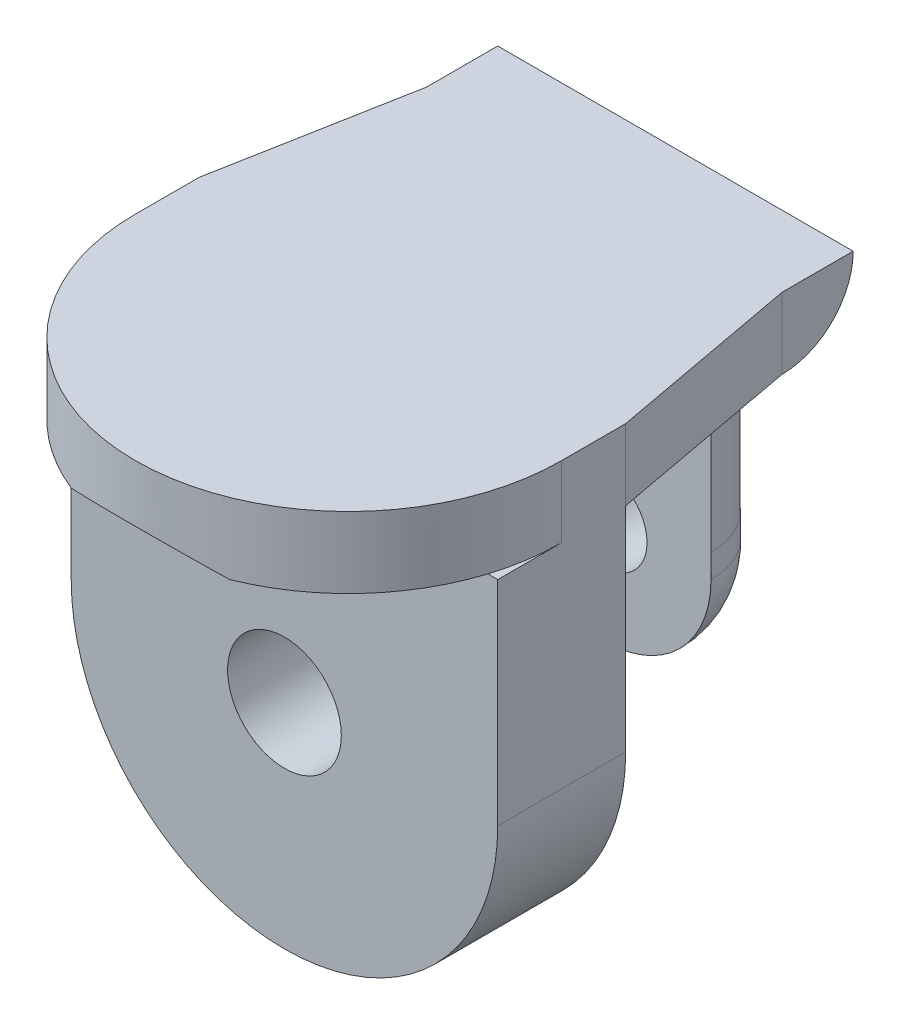
from build123d import *

# Parameters (mm, degrees)
SKETCH1_R            = 15
BOSS_EXTRUDE1_DEPTH  = 30
SKETCH8_W            = 30
SKETCH8_H            = 15
REVOLVE1_ANGLE       = 180
SKETCH9_W            = 30
SKETCH9_H            = 30
BOSS_EXTRUDE3_DEPTH  = 15
SKETCH10_R           = 5
CUT_EXTRUDE1_DEPTH   = 30
SKETCH13_R           = 16
CUT_EXTRUDE2_DEPTH   = 10
SKETCH14_W           = 10
SKETCH14_H           = 15
CUT_EXTRUDE3_DEPTH   = 67
CUT_EXTRUDE4_START   = -7
SKETCH15_R           = 11
SKETCH15_R_2         = 5
CUT_EXTRUDE4_DEPTH   = 7
SKETCH16_R           = 11
SKETCH16_R_2         = 5
CUT_EXTRUDE5_DEPTH   = 7
SKETCH17_R           = 15
SKETCH17_R_2         = 8
SKETCH17_R_3         = 3.5
BOSS_EXTRUDE4_DEPTH  = 2
BOSS_EXTRUDE5_DEPTH  = 5
BOSS_EXTRUDE6_DEPTH  = 16
SKETCH21_W           = 53
SKETCH21_H           = 30
CUT_EXTRUDE7_DEPTH   = 20
SKETCH23_W           = 15
SKETCH23_H           = 9
SKETCH24_W           = 30
SKETCH24_H           = 9
BOSS_EXTRUDE7_DEPTH  = 15
SKETCH25_R           = 4
CUT_EXTRUDE8_DEPTH   = 15
BOSS_EXTRUDE8_START  = 3
SKETCH26_W           = 10
SKETCH26_H           = 15
BOSS_EXTRUDE8_DEPTH  = 5
SKETCH30_W           = 30
SKETCH30_H           = 15
BOSS_EXTRUDE9_DEPTH  = 3
SKETCH27_R           = 16
CUT_EXTRUDE9_DEPTH   = 16
SKETCH28_R           = 16
CUT_EXTRUDE10_DEPTH  = 10.5
SKETCH29_R           = 16
CUT_EXTRUDE12_DEPTH  = 10
SKETCH31_W           = 53
SKETCH31_H           = 41.496728026
CUT_EXTRUDE13_DEPTH  = 37
BOSS_EXTRUDE10_DEPTH = 5
SKETCH35_W           = 30
SKETCH35_H           = 9
BOSS_EXTRUDE11_DEPTH = 5
SKETCH36_R           = 16
CUT_EXTRUDE14_DEPTH  = 13.5
SKETCH37_R           = 16
CUT_EXTRUDE15_DEPTH  = 18.5
FILLET1_R            = 5


with BuildPart() as part:
    # Sketch1 → Boss-Extrude1 (new body)
    with BuildSketch(Plane(origin=(0, 0, 0), x_dir=(1, 0, 0), z_dir=(0, 1, 0))):
        with Locations(Location((0, 0, 0), (0, 0, 270))):
            Circle(SKETCH1_R)
    extrude(amount=BOSS_EXTRUDE1_DEPTH)

    # Sketch8 → Revolve1 (revolve)
    with BuildSketch(Plane(origin=(0, 30, 0), x_dir=(1, 0, 0), z_dir=(0, 1, 0))):
        with Locations((0, -7.5)):
            Rectangle(SKETCH8_W, SKETCH8_H)
    revolve(axis=Axis((15, 30, 0), (-1, 0, 0)), revolution_arc=REVOLVE1_ANGLE)

    # Sketch9 → Boss-Extrude3 (add)
    with BuildSketch(Plane.XZ.offset(-30)):
        Rectangle(SKETCH9_W, SKETCH9_H)
    extrude(amount=BOSS_EXTRUDE3_DEPTH)

    # Sketch10 → Cut-Extrude1 (cut)
    with BuildSketch(Plane(origin=(15, 0, 0), x_dir=(0, 0, -1), z_dir=(1, 0, 0))):
        with Locations((0, 30)):
            Circle(SKETCH10_R)
    extrude(amount=-CUT_EXTRUDE1_DEPTH, mode=Mode.SUBTRACT)

    # Sketch13 → Cut-Extrude2 (cut)
    with BuildSketch(Plane(origin=(5, 0, 0), x_dir=(0, 0, -1), z_dir=(1, 0, 0))):
        with Locations((0, 30)):
            Circle(SKETCH13_R)
    extrude(amount=-CUT_EXTRUDE2_DEPTH, mode=Mode.SUBTRACT)

    # Sketch14 → Cut-Extrude3 (cut)
    with BuildSketch(Plane.XY.offset(15)):
        with Locations((0, 22.5)):
            Rectangle(SKETCH14_W, SKETCH14_H)
    extrude(amount=-CUT_EXTRUDE3_DEPTH, mode=Mode.SUBTRACT)

    # Sketch15 → Cut-Extrude4 (cut)
    with BuildSketch(Plane.ZY.offset(15).offset(CUT_EXTRUDE4_START)):
        with Locations((0, 30)):
            Circle(SKETCH15_R)
        with Locations(Location((0, 30, 0), (0, 0, 180))):
            Circle(SKETCH15_R_2, mode=Mode.SUBTRACT)
    extrude(amount=CUT_EXTRUDE4_DEPTH, mode=Mode.SUBTRACT)

    # Sketch16 → Cut-Extrude5 (cut)
    with BuildSketch(Plane(origin=(15, 0, 0), x_dir=(0, 0, -1), z_dir=(1, 0, 0))):
        with Locations(Location((0, 30, 0), (0, 0, 180))):
            Circle(SKETCH16_R)
        with Locations((0, 30)):
            Circle(SKETCH16_R_2, mode=Mode.SUBTRACT)
    extrude(amount=-CUT_EXTRUDE5_DEPTH, mode=Mode.SUBTRACT)



with BuildPart() as body_2:
    # Sketch17 → Boss-Extrude4 (new body)
    # profile 1 of 4: a face of its own
    with BuildSketch(Plane.ZY.offset(31)):
        with Locations((0, 30)):
            Circle(SKETCH17_R)
        with Locations((0, 30)):
            Circle(SKETCH17_R_2, mode=Mode.SUBTRACT)
    # profile 2 of 4: a face of its own
    with BuildSketch(Plane.ZY.offset(31)):
        with Locations((0, 30)):
            Circle(SKETCH17_R_2)
        with Locations((0, 30)):
            Circle(SKETCH17_R_3, mode=Mode.SUBTRACT)
    # profile 3 of 4: a face of its own
    with BuildSketch(Plane.ZY.offset(31)):
        with BuildLine():
            ThreePointArc((0, 15), (-10.606601718, 19.393398282), (-15, 30))
            Line((-15, 30), (-15, 15))
            Line((-15, 15), (0, 15))
        make_face()
    # profile 4 of 4: a face of its own
    with BuildSketch(Plane.ZY.offset(31)):
        with BuildLine():
            Line((15, 15), (15, 30))
            ThreePointArc((15, 30), (10.606601718, 19.393398282), (0, 15))
            Line((0, 15), (15, 15))
        make_face()
    extrude(amount=BOSS_EXTRUDE4_DEPTH)

    # Sketch18 → Boss-Extrude5 (add)
    with BuildSketch(Plane.ZY.offset(33)):
        with BuildLine():
            ThreePointArc((-8.5, 30), (0, 38.5), (8.5, 30))
            Line((8.5, 30), (8.5, 15))
            Line((8.5, 15), (15, 15))
            Line((15, 15), (15, 30))
            ThreePointArc((15, 30), (0, 45), (-15, 30))
            Line((-15, 30), (-15, 15))
            Line((-15, 15), (-8.5, 15))
            Line((-8.5, 15), (-8.5, 30))
        make_face()
    extrude(amount=BOSS_EXTRUDE5_DEPTH)


with BuildPart() as part_1:
    add(part.part)

    add(body_2.part)  # Boss-Extrude6 merges body 2
    # Sketch20 → Boss-Extrude6 (add)
    with BuildSketch(Plane.ZY.offset(15)):
        with BuildLine():
            ThreePointArc((11.5, 30), (0, 18.5), (-11.5, 30))
            Line((-11.5, 30), (-15, 30))
            Line((-15, 30), (-15, 15))
            Line((-15, 15), (0, 15))
            Line((0, 15), (15, 15))
            Line((15, 15), (15, 30))
            Line((15, 30), (11.5, 30))
        make_face()
    extrude(amount=BOSS_EXTRUDE6_DEPTH)

    # Sketch21 → Cut-Extrude7 (cut)
    with BuildSketch(Plane.XZ.offset(-15)):
        with Locations((-11.5, 0)):
            Rectangle(SKETCH21_W, SKETCH21_H)
    extrude(amount=CUT_EXTRUDE7_DEPTH, mode=Mode.SUBTRACT)


with BuildPart() as cut_extrude7_piece_1:
    # of the separate pieces the step leaves, piece 1, a body of its own (cut_extrude7_pieces)
    add(part_1.part.solids().sort_by_distance((-31, 30, 15))[0])



with BuildPart() as cut_extrude7_piece_2:
    # of the separate pieces the step leaves, piece 2, a body of its own (cut_extrude7_pieces)
    add(part_1.part.solids().sort_by_distance((5, 15, -15))[0])


with BuildPart() as body_3:
    # Sketch23 → Revolve2 (revolve)
    with BuildSketch(Plane(origin=(0, 0, 0), x_dir=(-1, 0, 0), z_dir=(0, -1, 0)), mode=Mode.PRIVATE) as revolve2_sk:
        with Locations((-7.5, 0)):
            Rectangle(SKETCH23_W, SKETCH23_H)
    revolve(revolve2_sk.sketch.rotate(Axis((0, 0, 4.5), (0, 0, -1)), 90), axis=Axis((0, 0, 4.5), (0, 0, -1)))


with BuildPart() as cut_extrude7_piece_1_1:
    add(cut_extrude7_piece_1.part)

    add(cut_extrude7_piece_2.part)  # Boss-Extrude7 merges Cut-Extrude7 piece 2

    add(body_3.part)  # Boss-Extrude7 merges body 3
    # Sketch24 → Boss-Extrude7 (add)
    with BuildSketch(Plane.XZ.offset(-15)):
        Rectangle(SKETCH24_W, SKETCH24_H)
    extrude(amount=BOSS_EXTRUDE7_DEPTH)

    # Sketch25 → Cut-Extrude8 (cut)
    with BuildSketch(Plane.XY.offset(4.5)):
        Circle(SKETCH25_R)
    extrude(amount=-CUT_EXTRUDE8_DEPTH, mode=Mode.SUBTRACT)



with BuildPart() as body_2_2:
    # Sketch26 → Boss-Extrude8 (new body)
    with BuildSketch(Plane(origin=(0, 0, -15), x_dir=(-1, 0, 0), z_dir=(0, 0, -1)).offset(BOSS_EXTRUDE8_START)):
        with Locations((-10, 22.5)):
            Rectangle(SKETCH26_W, SKETCH26_H)
        with BuildLine():
            Line((15, 30), (-5, 30))
            Line((-5, 30), (-5, 15))
            Line((-5, 15), (-12.5, 15))
            ThreePointArc((-12.5, 15), (-8.964466094, 13.535533906), (-7.5, 10))
            Line((-7.5, 10), (-7.5, 0))
            ThreePointArc((-7.5, 0), (0, 7.5), (7.5, 0))
            Line((7.5, 0), (7.5, 10))
            ThreePointArc((7.5, 10), (8.964466094, 13.535533906), (12.5, 15))
            Line((12.5, 15), (15, 15))
            Line((15, 15), (15, 30))
        make_face()
        with BuildLine():
            ThreePointArc((7.5, 0), (0, 7.5), (-7.5, 0))
            Line((-7.5, 0), (-3, 0))
            ThreePointArc((-3, 0), (0, 3), (3, 0))
            Line((3, 0), (7.5, 0))
        make_face()
        with BuildLine():
            Line((-3, 0), (-7.5, 0))
            ThreePointArc((-7.5, 0), (0, -7.5), (7.5, 0))
            Line((7.5, 0), (3, 0))
            ThreePointArc((3, 0), (0, -3), (-3, 0))
        make_face()
    extrude(amount=BOSS_EXTRUDE8_DEPTH)


with BuildPart() as cut_extrude7_piece_1_2:
    add(cut_extrude7_piece_1_1.part)

    add(body_2_2.part)  # Boss-Extrude9 merges body 2 2
    # Sketch30 → Boss-Extrude9 (add)
    with BuildSketch(Plane.XY.offset(-18)):
        with Locations((0, 22.5)):
            Rectangle(SKETCH30_W, SKETCH30_H)
    extrude(amount=BOSS_EXTRUDE9_DEPTH)

    # Sketch27 → Cut-Extrude9 (cut)
    with BuildSketch(Plane.XY.offset(4.5)):
        Circle(SKETCH27_R)
    extrude(amount=CUT_EXTRUDE9_DEPTH, mode=Mode.SUBTRACT)

    # Sketch28 → Cut-Extrude10 (cut)
    with BuildSketch(Plane(origin=(0, 0, -4.5), x_dir=(-1, 0, 0), z_dir=(0, 0, -1))):
        Circle(SKETCH28_R)
    extrude(amount=CUT_EXTRUDE10_DEPTH, mode=Mode.SUBTRACT)

    # Sketch29 → Cut-Extrude12 (cut)
    with BuildSketch(Plane.ZY.offset(-5)):
        with Locations((0, 30)):
            Circle(SKETCH29_R)
    extrude(amount=CUT_EXTRUDE12_DEPTH, mode=Mode.SUBTRACT)

    # Sketch31 → Cut-Extrude13 (cut)
    with BuildSketch(Plane.XZ.offset(-15)):
        with Locations((-11.5, -5.748364013)):
            Rectangle(SKETCH31_W, SKETCH31_H)
    extrude(amount=-CUT_EXTRUDE13_DEPTH, mode=Mode.SUBTRACT)


with BuildPart() as cut_extrude13_piece_1:
    # of the separate pieces the step leaves, piece 1, a body of its own (cut_extrude13_pieces)
    add(cut_extrude7_piece_1_2.part.solids().sort_by_distance((5, 14.645847467, 4.5))[0])



with BuildPart() as cut_extrude13_piece_2:
    # of the separate pieces the step leaves, piece 2, a body of its own (cut_extrude13_pieces)
    add(cut_extrude7_piece_1_2.part.solids().sort_by_distance((-7.5, 10, -18))[0])


with BuildPart() as cut_extrude13_piece_1_1:
    add(cut_extrude13_piece_1.part)

    add(cut_extrude13_piece_2.part)  # Boss-Extrude10 merges Cut-Extrude13 piece 2
    # Sketch33 → Boss-Extrude10 (add)
    with BuildSketch(Plane(origin=(0, 15, 0), x_dir=(1, 0, 0), z_dir=(0, 1, 0))):
        with BuildLine():
            Line((12.5, 23), (-12.5, 23))
            Line((-12.5, 23), (-12.5, 18))
            Line((-12.5, 18), (-15, 4.5))
            Line((-15, 4.5), (-15, 0))
            ThreePointArc((-15, 0), (0, -15), (15, 0))
            Line((15, 0), (15, 4.5))
            Line((15, 4.5), (12.5, 18))
            Line((12.5, 18), (12.5, 23))
        make_face()
    extrude(amount=BOSS_EXTRUDE10_DEPTH)

    # Sketch35 → Boss-Extrude11 (add)
    with BuildSketch(Plane.XZ.offset(-15)):
        Rectangle(SKETCH35_W, SKETCH35_H)
    extrude(amount=BOSS_EXTRUDE11_DEPTH)

    # Sketch36 → Cut-Extrude14 (cut)
    with BuildSketch(Plane(origin=(0, 0, -4.5), x_dir=(-1, 0, 0), z_dir=(0, 0, -1))):
        Circle(SKETCH36_R)
    extrude(amount=CUT_EXTRUDE14_DEPTH, mode=Mode.SUBTRACT)

    # Sketch37 → Cut-Extrude15 (cut)
    with BuildSketch(Plane.XY.offset(4.5)):
        Circle(SKETCH37_R)
    extrude(amount=CUT_EXTRUDE15_DEPTH, mode=Mode.SUBTRACT)

    # Fillet1
    fillet1_edges = [cut_extrude13_piece_1_1.edges().sort_by_distance(p)[0] for p in [
        (-8.964466094, 13.535533906, -23),
        (8.964466094, 13.535533906, -23),
        (7.5, 5, -23),
        (-7.5, 5, -23),
    ]]
    fillet(fillet1_edges, radius=FILLET1_R - 0.0001)  # a hair under: the kernel refuses the full size


solid = cut_extrude13_piece_1_1.part
